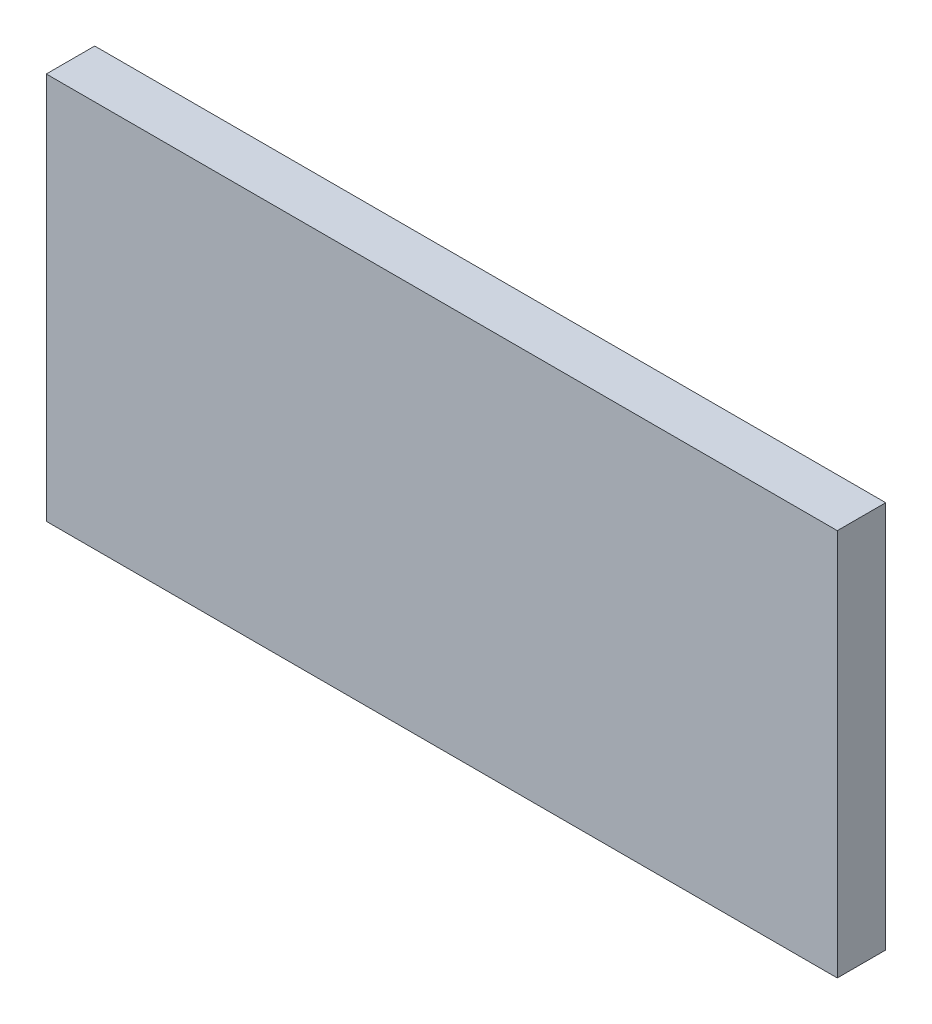
from build123d import *

# Parameters (mm, degrees)
SKETCH1_W      = 196
SKETCH1_H      = 96
EXTRUDE1_DEPTH = 12


with BuildPart() as part:
    # Sketch1 → Extrude1 (new body)
    with BuildSketch(Plane.XY):
        Rectangle(SKETCH1_W, SKETCH1_H)
    extrude(amount=-EXTRUDE1_DEPTH)


solid = part.part
